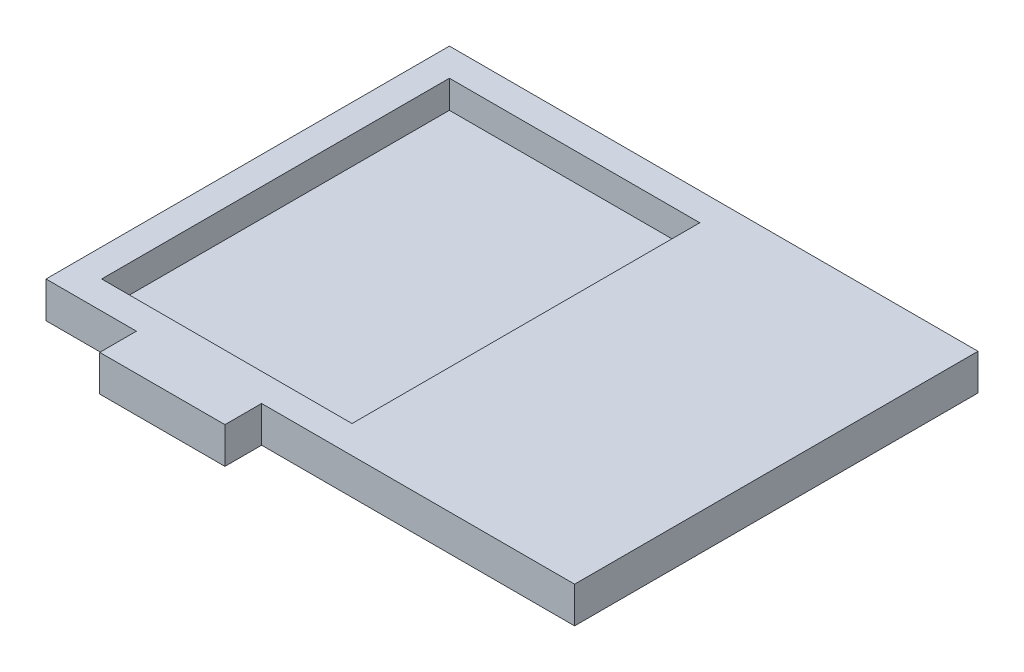
from build123d import *

# Parameters (mm, degrees)
BOSS_EXTRUDE1_DEPTH = 3
BOSS_EXTRUDE2_DEPTH = 10


with BuildPart() as part:
    # Sketch1 → Boss-Extrude1 (new body)
    with BuildSketch(Plane(origin=(0, 0, 0), x_dir=(1, 0, 0), z_dir=(0, 1, 0))):
        Polygon((-10, 135), (-10, -10), (22.5, -10), (22.5, -23.183655632), (67.5, -23.183655632), (67.5, -10), (180, -10), (180, 135), align=None)
    extrude(amount=-BOSS_EXTRUDE1_DEPTH)

    # Sketch1<3> → Boss-Extrude2 (add)
    with BuildSketch(Plane(origin=(0, 0, 0), x_dir=(1, 0, 0), z_dir=(0, 1, 0))):
        Polygon((-10, -10), (22.5, -10), (22.5, -23.183655632), (67.5, -23.183655632), (67.5, -10), (180, -10), (180, 135), (-10, 135), align=None)
        Polygon((90, 0), (45, 0), (0, 0), (0, 125), (90, 125), align=None, mode=Mode.SUBTRACT)
    extrude(amount=BOSS_EXTRUDE2_DEPTH)


solid = part.part
